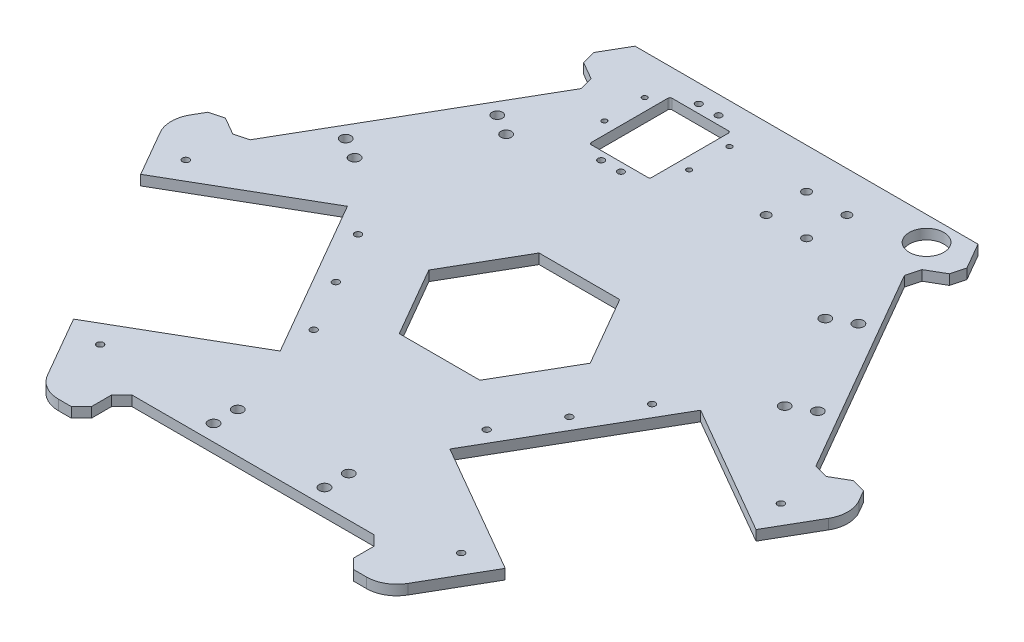
from build123d import *

# Parameters (mm, degrees)
EXTRUDE_1_DEPTH             = 5
CUT_EXTRUDE_31_REACH        = 226.944
SKETCH_46_W                 = 130
SKETCH_46_H                 = 20
SKETCH_8_R                  = 2.6
CUT_EXTRUDE_6_DEPTH         = 225.944437584
PATTERN_CIRCULAR_1_COUNT    = 3
CHAMFER_1_SIZE              = 5
CUT_EXTRUDE_4_DEPTH         = 225.944437584
SKETCH_9_R                  = 1.65
CUT_EXTRUDE_7_DEPTH         = 225.944437584
FILLET_1_R                  = 15
M4X0_7_4_D                  = 3.3
CUT_EXTRUDE_35_REACH        = 225.196
CUT_EXTRUDE_37_REACH        = 225.196
SKETCH_53_R                 = 2.1
PATTERN_LINEAR_1_COUNT      = 2
PATTERN_LINEAR_1_PITCH      = 20
PATTERN_LINEAR_1_COUNT_DIR2 = 2
PATTERN_LINEAR_1_PITCH_DIR2 = 20
CUT_EXTRUDE_38_REACH        = 225.196
SKETCH_54_R                 = 8.55
SKETCH_56_R                 = 1.6
CUT_EXTRUDE_40_DEPTH        = 10
SKETCH_55_W                 = 30
SKETCH_55_H                 = 40
CUT_EXTRUDE_39_DEPTH        = 10
FILLET_2_R                  = 1
M3X0_5_1_D                  = 2.5
M3X0_5_1_DEPTH              = 8.5
M3X0_5_1_TIP                = 0.751075774


with BuildPart() as part:
    # 草圖1 → 填料-伸長1 (new body)
    with BuildSketch(Plane(origin=(0, 0, 0), x_dir=(1, 0, 0), z_dir=(0, 1, 0))):
        Polygon((85, 147.224318643), (-85, 147.224318643), (-170, 0), (-85, -147.224318643), (85, -147.224318643), (170, 0), align=None)
    extrude(amount=EXTRUDE_1_DEPTH)

    # 草圖46 → 除料-伸長31 (cut, up to next)
    with BuildSketch(Plane(origin=(0, 5, 0), x_dir=(1, 0, 0), z_dir=(0, 1, 0)), mode=Mode.PRIVATE) as cut_extrude_31_sk1:
        with Locations((0, -137.224318643)):
            Rectangle(SKETCH_46_W, SKETCH_46_H)
    cut_extrude_31_tool1 = extrude(cut_extrude_31_sk1.sketch, amount=-CUT_EXTRUDE_31_REACH, mode=Mode.PRIVATE) & part.part
    cut_extrude_31 = cut_extrude_31_tool1.solids().sort_by_distance((0, 5, 137.224319))[0]
    add(cut_extrude_31, mode=Mode.SUBTRACT)

    # 草圖8 → 除料-伸長6 (cut, through all)
    with BuildSketch(Plane(origin=(0, 5, 0), x_dir=(1, 0, 0), z_dir=(0, 1, 0))):
        with Locations((-27.5, -119.224318643)):
            Circle(SKETCH_8_R)
        with Locations((27.5, -119.224318643)):
            Circle(SKETCH_8_R)
        with Locations((-27.5, -107.224318643)):
            Circle(SKETCH_8_R)
        with Locations((27.5, -107.224318643)):
            Circle(SKETCH_8_R)
    cut_extrude_6 = extrude(amount=-CUT_EXTRUDE_6_DEPTH, mode=Mode.SUBTRACT)

    # 環狀複製排列1: 除料-伸長31, 除料-伸長6 ×3 about axis
    pattern_circular_1_axis = Axis((0, -0.25, 0), (0, 1, 0))
    add([cut_extrude_31.rotate(pattern_circular_1_axis, i * 360 / PATTERN_CIRCULAR_1_COUNT) for i in range(1, PATTERN_CIRCULAR_1_COUNT)], mode=Mode.SUBTRACT)
    add([cut_extrude_6.rotate(pattern_circular_1_axis, i * 360 / PATTERN_CIRCULAR_1_COUNT) for i in range(1, PATTERN_CIRCULAR_1_COUNT)], mode=Mode.SUBTRACT)

    # 導角1
    chamfer_1_edges = [part.edges().sort_by_distance(p)[0] for p in [
        (65, 2.5, 127.224318643),
        (65, 2.5, 147.224318643),
        (-65, 2.5, 147.224318643),
        (-65, 2.5, 127.224318643),
        (77.679491924, 2.5, -119.903810568),
        (95, 2.5, -129.903810568),
        (160, 2.5, -17.320508076),
        (142.679491924, 2.5, -7.320508076),
        (-160, 2.5, -17.320508076),
        (-142.679491924, 2.5, -7.320508076),
        (-77.679491924, 2.5, -119.903810568),
        (-95, 2.5, -129.903810568),
    ]]
    chamfer(chamfer_1_edges, length=CHAMFER_1_SIZE)

    # 草圖5 → 除料-伸長4 (cut, through all)
    with BuildSketch(Plane(origin=(0, 5, 0), x_dir=(1, 0, 0), z_dir=(0, 1, 0))):
        Polygon((-152.5, -30.310889132), (-107, -109.119200877), (-42.048094716, -71.619200877), (-87.548094716, 7.189110868), align=None)
    cut_extrude_4 = extrude(amount=-CUT_EXTRUDE_4_DEPTH, mode=Mode.SUBTRACT)

    # 草圖9 → 除料-伸長7 (cut, through all)
    with BuildSketch(Plane(origin=(0, 5, 0), x_dir=(1, 0, 0), z_dir=(0, 1, 0))):
        with Locations((-89.491669751, -113.444518424)):
            Circle(SKETCH_9_R)
        with Locations((-147.491669751, -12.985571585)):
            Circle(SKETCH_9_R)
    cut_extrude_7 = extrude(amount=-CUT_EXTRUDE_7_DEPTH, mode=Mode.SUBTRACT)

    # 鏡射1: 除料-伸長4, 除料-伸長7 across plane
    add(cut_extrude_4.mirror(Plane(origin=(0, 0, 0), x_dir=(0, 0, 1), z_dir=(1, 0, 0))), mode=Mode.SUBTRACT)
    add(cut_extrude_7.mirror(Plane(origin=(0, 0, 0), x_dir=(0, 0, 1), z_dir=(1, 0, 0))), mode=Mode.SUBTRACT)

    # 圓角1
    fillet_1_edges = [part.edges().sort_by_distance(p)[0] for p in [
        (170, 2.5, 0),
        (85, 2.5, 147.224318643),
        (-170, 2.5, 0),
        (-85, 2.5, 147.224318643),
    ]]
    fillet(fillet_1_edges, radius=FILLET_1_R)

    # M4x0.7 螺紋孔4 (through all)
    with Locations(Plane(origin=(0, 5, 0), x_dir=(1, 0, 0), z_dir=(0, 1, 0))):
        with Locations((-72.869891486, -2.234282891), (-57.869891486, -28.215045005), (-42.869891486, -54.195807118)):
            m4x0_7_4 = Hole(M4X0_7_4_D / 2)

    # 鏡射2: M4x0.7 螺紋孔4 across plane
    add(m4x0_7_4.mirror(Plane(origin=(0, 0, 0), x_dir=(0, 0, 1), z_dir=(1, 0, 0))), mode=Mode.SUBTRACT)

    # 草圖51 → 除料-伸長35 (cut, up to next)
    with BuildSketch(Plane(origin=(0, 5, 0), x_dir=(1, 0, 0), z_dir=(0, 1, 0)), mode=Mode.PRIVATE) as cut_extrude_35_sk1:
        Polygon((20, 34.641016151), (-20, 34.641016151), (-40, 0), (-20, -34.641016151), (20, -34.641016151), (40, 0), align=None)
    cut_extrude_35_tool1 = extrude(cut_extrude_35_sk1.sketch, amount=-CUT_EXTRUDE_35_REACH, mode=Mode.PRIVATE) & part.part
    add(cut_extrude_35_tool1.solids().sort_by_distance((0, 5, 0))[0], mode=Mode.SUBTRACT)

    # 草圖53 → 除料-伸長37 (cut, up to next)
    with BuildSketch(Plane(origin=(0, 5, 0), x_dir=(1, 0, 0), z_dir=(0, 1, 0)), mode=Mode.PRIVATE) as cut_extrude_37_sk1:
        with Locations((20, 127.224318643)):
            Circle(SKETCH_53_R)
    cut_extrude_37_tool1 = extrude(cut_extrude_37_sk1.sketch, amount=-CUT_EXTRUDE_37_REACH, mode=Mode.PRIVATE) & part.part
    cut_extrude_37 = cut_extrude_37_tool1.solids().sort_by_distance((20, 5, -127.224319))[0]
    add(cut_extrude_37, mode=Mode.SUBTRACT)

    # 直線複製排列1: Cut-Extrude 37 2 × 2
    with Locations(*[(i * PATTERN_LINEAR_1_PITCH, 0, j * PATTERN_LINEAR_1_PITCH_DIR2) for i in range(PATTERN_LINEAR_1_COUNT) for j in range(PATTERN_LINEAR_1_COUNT_DIR2) if (i, j) != (0, 0)]):
        add(cut_extrude_37, mode=Mode.SUBTRACT)

    # 草圖54 → 除料-伸長38 (cut, up to next)
    with BuildSketch(Plane(origin=(0, 5, 0), x_dir=(1, 0, 0), z_dir=(0, 1, 0)), mode=Mode.PRIVATE) as cut_extrude_38_sk1:
        with Locations((71.5, 135.224318643)):
            Circle(SKETCH_54_R)
    cut_extrude_38_tool1 = extrude(cut_extrude_38_sk1.sketch, amount=-CUT_EXTRUDE_38_REACH, mode=Mode.PRIVATE) & part.part
    add(cut_extrude_38_tool1.solids().sort_by_distance((71.5, 5, -135.224319))[0], mode=Mode.SUBTRACT)

    # 草圖56 → 除料-伸長40 (cut)
    with BuildSketch(Plane(origin=(0, 0, 0), x_dir=(-1, 0, 0), z_dir=(0, -1, 0))):
        with Locations((34.6, 138.224318643)):
            Circle(SKETCH_56_R)
        with Locations((44.4, 138.224318643)):
            Circle(SKETCH_56_R)
        with Locations((44.4, 89.824318643)):
            Circle(SKETCH_56_R)
        with Locations((34.6, 89.824318643)):
            Circle(SKETCH_56_R)
    extrude(amount=-CUT_EXTRUDE_40_DEPTH, mode=Mode.SUBTRACT)

    # 草圖55 → 除料-伸長39 (cut)
    with BuildSketch(Plane(origin=(0, 5, 0), x_dir=(1, 0, 0), z_dir=(0, 1, 0))):
        with Locations((-39.5, 114.024318643)):
            Rectangle(SKETCH_55_W, SKETCH_55_H)
    extrude(amount=-CUT_EXTRUDE_39_DEPTH, mode=Mode.SUBTRACT)

    # 圓角2
    fillet_2_edges = [part.edges().sort_by_distance(p)[0] for p in [
        (-54.5, 2.5, -94.024318643),
        (-24.5, 2.5, -94.024318643),
        (-24.5, 2.5, -134.024318643),
        (-54.5, 2.5, -134.024318643),
    ]]
    fillet(fillet_2_edges, radius=FILLET_2_R)

    # M3x0.5 螺紋孔1
    with Locations(Plane(origin=(0, 5, 0), x_dir=(1, 0, 0), z_dir=(0, 1, 0))):
        with Locations((-60.5, 127.524318643), (-60.5, 107.524318643), (-18.5, 107.524318643), (-18.5, 127.524318643)):
            Hole(M3X0_5_1_D / 2, depth=M3X0_5_1_DEPTH)
            with Locations((0, 0, -(M3X0_5_1_DEPTH + M3X0_5_1_TIP / 2))):  # 118° drill point
                Cone(0, M3X0_5_1_D / 2, M3X0_5_1_TIP, mode=Mode.SUBTRACT)


solid = part.part
